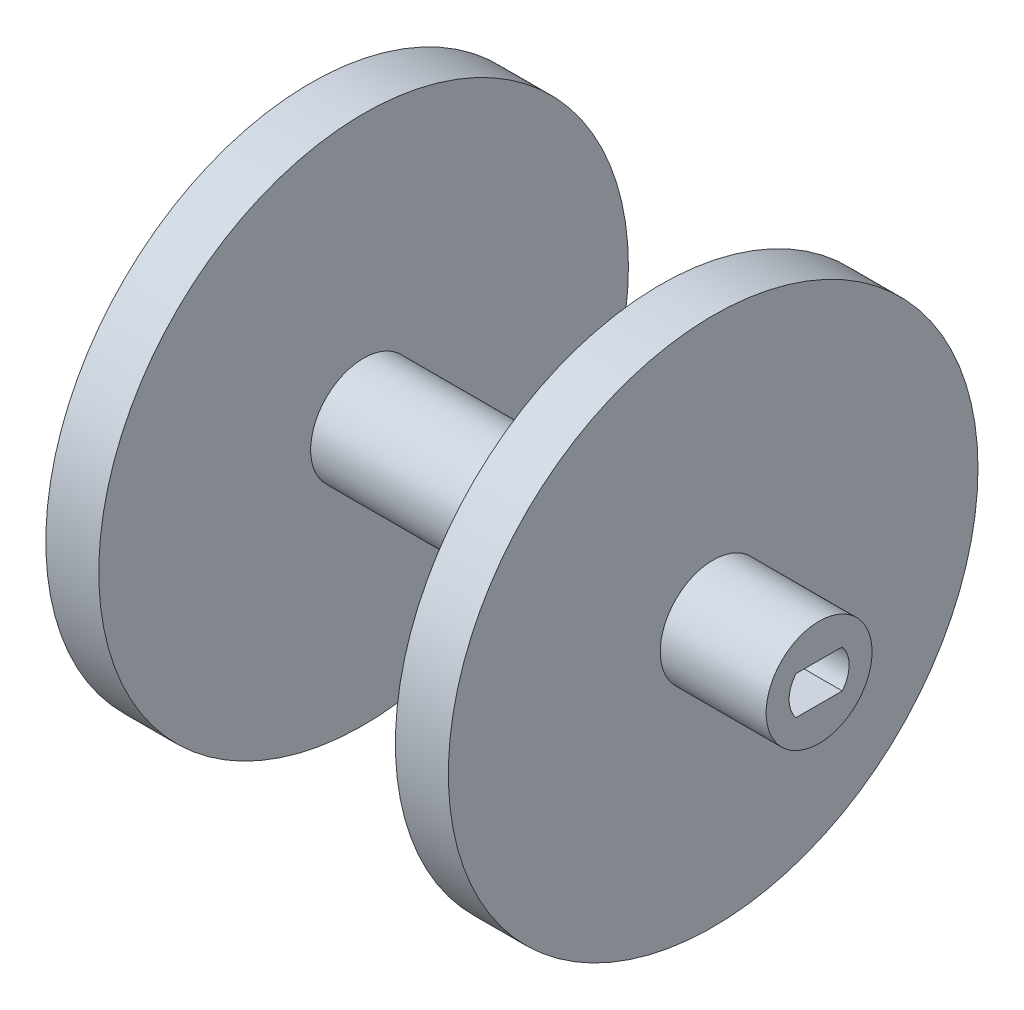
from build123d import *

# Parameters (mm, degrees)
CUT_EXTRUDE2_DEPTH = 5.715


with BuildPart() as part:
    # Sketch2 → Revolve1 (revolve)
    with BuildSketch(Plane.XY):
        Polygon((0, 31.75), (6.35, 31.75), (6.35, 6.35), (41.91, 6.35), (41.91, 31.75), (48.26, 31.75), (48.26, 6.35), (60.96, 6.35), (60.96, 0), (48.26, 0), (0, 0), (-12.7, 0), (-12.7, 6.35), (0, 6.35), align=None)
    revolve(axis=Axis((48.26, 0, 0), (-1, 0, 0)))

    # Sketch8 → Cut-Extrude2 (cut)
    with BuildSketch(Plane(origin=(60.96, 0, 0), x_dir=(0, 0, -1), z_dir=(1, 0, 0))):
        with BuildLine():
            Line((2.776494522, 2.286), (-2.776494522, 2.286))
            ThreePointArc((-2.776494522, 2.286), (-3.596486873, 0), (-2.776494522, -2.286))
            Line((-2.776494522, -2.286), (2.776494522, -2.286))
            ThreePointArc((2.776494522, -2.286), (3.385287575, -1.214308801), (3.596486873, 0))
            ThreePointArc((3.596486873, 0), (3.385287575, 1.214308801), (2.776494522, 2.286))
        make_face()
    extrude(amount=-CUT_EXTRUDE2_DEPTH, mode=Mode.SUBTRACT)


solid = part.part
